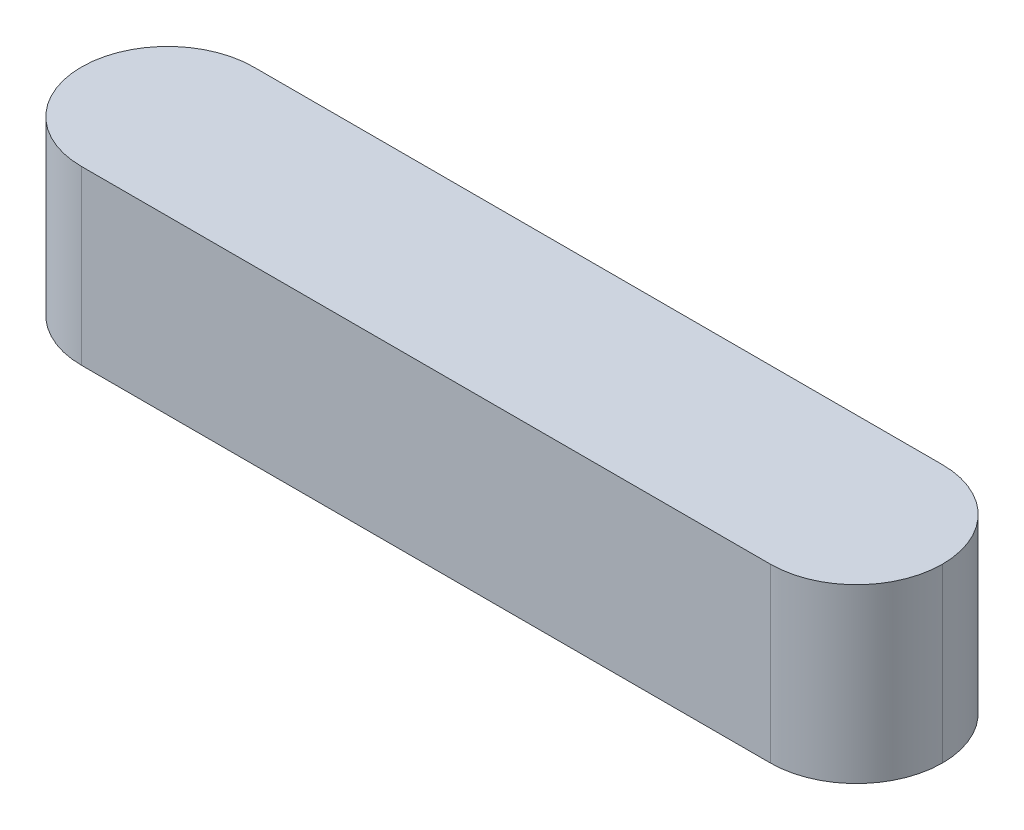
from build123d import *

# Parameters (mm, degrees)
SKETCH1_W      = 20
SKETCH1_H      = 4
EXTRUDE1_DEPTH = 4
FILLET1_R      = 2


with BuildPart() as part:
    # Sketch1 → Extrude1 (new body)
    with BuildSketch(Plane(origin=(0, 0, 0), x_dir=(1, 0, 0), z_dir=(0, 1, 0))):
        with Locations((10, 2)):
            Rectangle(SKETCH1_W, SKETCH1_H)
    extrude(amount=EXTRUDE1_DEPTH)

    # Fillet1
    fillet1_edges = [part.edges().sort_by_distance(p)[0] for p in [
        (0, 2, -4),
        (0, 2, 0),
        (20, 2, -4),
        (20, 2, 0),
    ]]
    fillet(fillet1_edges, radius=FILLET1_R - 0.0001)  # a hair under: the kernel refuses the full size


solid = part.part
